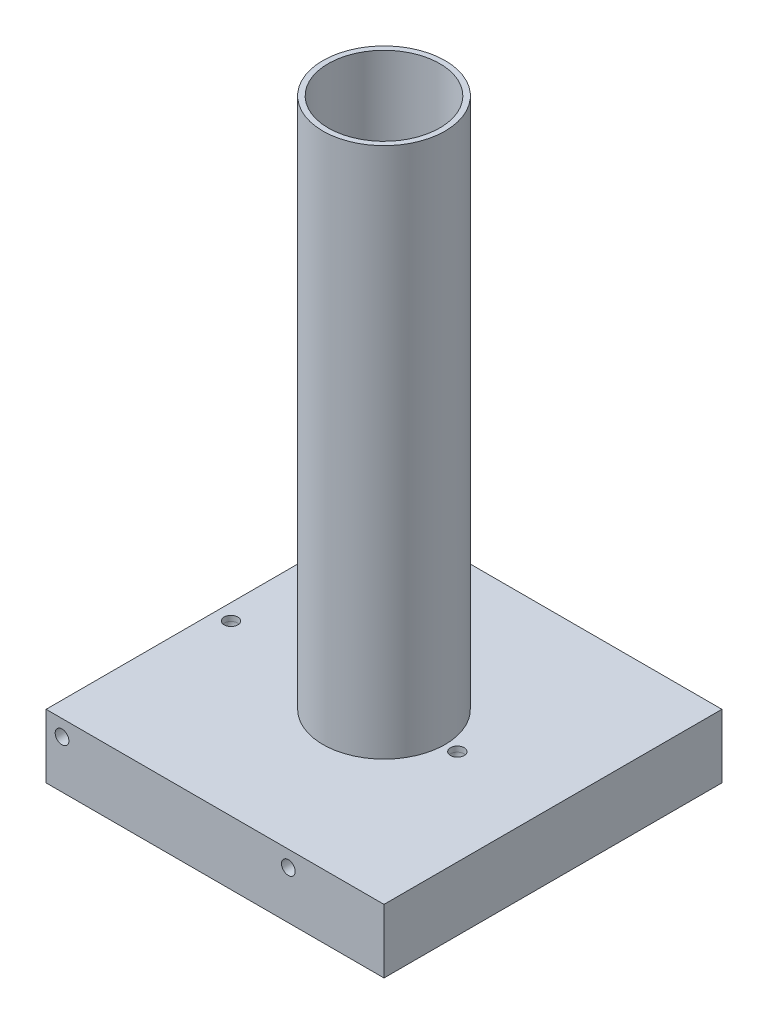
from build123d import *

# Parameters (mm, degrees)
SKETCH1_W           = 31.8
SKETCH1_H           = 31.8
BOSS_EXTRUDE2_DEPTH = 6
SKETCH5_R           = 3.255
SKETCH5_R_2         = 2.4
CUT_EXTRUDE2_DEPTH  = 2
SKETCH6_R           = 5
CUT_EXTRUDE3_DEPTH  = 2
SKETCH7_R           = 5.75
SKETCH7_R_2         = 5.25
BOSS_EXTRUDE4_DEPTH = 50
SKETCH10_R          = 0.64516


with BuildPart() as part:
    # Sketch1 → Boss-Extrude2 (new body)
    with BuildSketch(Plane(origin=(0, 0, 0), x_dir=(1, 0, 0), z_dir=(0, 1, 0))):
        with Locations((15.9, 15.9)):
            Rectangle(SKETCH1_W, SKETCH1_H)
    extrude(amount=-BOSS_EXTRUDE2_DEPTH)

    # Sketch5 → Cut-Extrude2 (cut)
    # profile 1 of 10: a face of its own
    with BuildSketch(Plane.XZ.offset(6)):
        Polygon((20.2, -1.5), (19.6, -1.5), (19.6, -1.2), (12.2, -1.2), (12.2, -1.5), (11.6, -1.5), (11.6, -1.2), (4.2, -1.2), (4.2, -1.5), (3.6, -1.5), (3.6, -1.2), (1.2, -1.2), (1.2, -3.6), (1.5, -3.6), (1.5, -4.2), (1.2, -4.2), (1.2, -11.6), (1.5, -11.6), (1.5, -12.2), (1.2, -12.2), (1.2, -19.6), (1.5, -19.6), (1.5, -20.2), (1.2, -20.2), (1.2, -27.6), (1.5, -27.6), (1.5, -28.2), (1.2, -28.2), (1.2, -30.6), (3.6, -30.6), (3.6, -30.3), (4.2, -30.3), (4.2, -30.6), (11.6, -30.6), (11.6, -30.3), (12.2, -30.3), (12.2, -30.6), (19.6, -30.6), (19.6, -30.3), (20.2, -30.3), (20.2, -30.6), (27.6, -30.6), (27.6, -30.3), (28.2, -30.3), (28.2, -30.6), (30.6, -30.6), (30.6, -28.2), (30.3, -28.2), (30.3, -27.6), (30.6, -27.6), (30.6, -20.2), (30.3, -20.2), (30.3, -19.6), (30.6, -19.6), (30.6, -12.2), (30.3, -12.2), (30.3, -11.6), (30.6, -11.6), (30.6, -4.2), (30.3, -4.2), (30.3, -3.6), (30.6, -3.6), (30.6, -1.2), (28.2, -1.2), (28.2, -1.5), (27.6, -1.5), (27.6, -1.2), (20.2, -1.2), align=None)
        with Locations((7.9, -23.9)):
            Circle(SKETCH5_R, mode=Mode.SUBTRACT)
        with Locations((7.9, -15.9)):
            Circle(SKETCH5_R, mode=Mode.SUBTRACT)
        with Locations((15.9, -23.9)):
            Circle(SKETCH5_R, mode=Mode.SUBTRACT)
        with Locations((23.9, -23.9)):
            Circle(SKETCH5_R, mode=Mode.SUBTRACT)
        with Locations((15.9, -15.9)):
            Circle(SKETCH5_R, mode=Mode.SUBTRACT)
        with Locations((7.9, -7.9)):
            Circle(SKETCH5_R, mode=Mode.SUBTRACT)
        with Locations((23.9, -15.9)):
            Circle(SKETCH5_R, mode=Mode.SUBTRACT)
        with Locations((15.9, -7.9)):
            Circle(SKETCH5_R, mode=Mode.SUBTRACT)
        with Locations((23.9, -7.9)):
            Circle(SKETCH5_R, mode=Mode.SUBTRACT)
    # profile 2 of 10: a face of its own
    with BuildSketch(Plane.XZ.offset(6)):
        with Locations((23.9, -7.9)):
            Circle(SKETCH5_R_2)
    # profile 3 of 10: a face of its own
    with BuildSketch(Plane.XZ.offset(6)):
        with Locations((15.9, -7.9)):
            Circle(SKETCH5_R_2)
    # profile 4 of 10: a face of its own
    with BuildSketch(Plane.XZ.offset(6)):
        with Locations((7.9, -7.9)):
            Circle(SKETCH5_R_2)
    # profile 5 of 10: a face of its own
    with BuildSketch(Plane.XZ.offset(6)):
        with Locations((15.9, -15.9)):
            Circle(SKETCH5_R_2)
    # profile 6 of 10: a face of its own
    with BuildSketch(Plane.XZ.offset(6)):
        with Locations((7.9, -15.9)):
            Circle(SKETCH5_R_2)
    # profile 7 of 10: a face of its own
    with BuildSketch(Plane.XZ.offset(6)):
        with Locations((15.9, -23.9)):
            Circle(SKETCH5_R_2)
    # profile 8 of 10: a face of its own
    with BuildSketch(Plane.XZ.offset(6)):
        with Locations((7.9, -23.9)):
            Circle(SKETCH5_R_2)
    # profile 9 of 10: a face of its own
    with BuildSketch(Plane.XZ.offset(6)):
        with Locations((23.9, -15.9)):
            Circle(SKETCH5_R_2)
    # profile 10 of 10: a face of its own
    with BuildSketch(Plane.XZ.offset(6)):
        with Locations((23.9, -23.9)):
            Circle(SKETCH5_R_2)
    extrude(amount=-CUT_EXTRUDE2_DEPTH, mode=Mode.SUBTRACT)

    # Sketch6 → Cut-Extrude3 (cut)
    with BuildSketch(Plane(origin=(0, 0, 0), x_dir=(1, 0, 0), z_dir=(0, 1, 0))):
        with Locations((15.9, 15.9)):
            Circle(SKETCH6_R)
    extrude(amount=-CUT_EXTRUDE3_DEPTH, mode=Mode.SUBTRACT)

    # Sketch7 → Boss-Extrude4 (add)
    with BuildSketch(Plane(origin=(0, 0, 0), x_dir=(1, 0, 0), z_dir=(0, 1, 0))):
        with Locations((15.9, 15.9)):
            Circle(SKETCH7_R)
        with Locations((15.9, 15.9)):
            Circle(SKETCH7_R_2, mode=Mode.SUBTRACT)
    extrude(amount=BOSS_EXTRUDE4_DEPTH)

    # Cut-Sweep1: sweep along a path in Sketch12
    with BuildLine(Plane(origin=(22.8, 0, 0), x_dir=(0, 0, -1), z_dir=(1, 0, 0))) as cut_sweep1_path:
        Line((0, -1.5), (14.9, -1.5))
        ThreePointArc((14.9, -1.5), (15.607106781, -1.207106781), (15.9, -0.5))
        Line((15.9, -0.5), (15.9, 0))
    # Sketch10 → Cut-Sweep1 (sweep, cut)
    with BuildSketch(Plane.XY):
        with Locations((1.5, -1.5)):
            Circle(SKETCH10_R)
        with Locations((22.8, -1.5)):
            Circle(SKETCH10_R)
    sweep(path=cut_sweep1_path.line, mode=Mode.SUBTRACT)


solid = part.part
